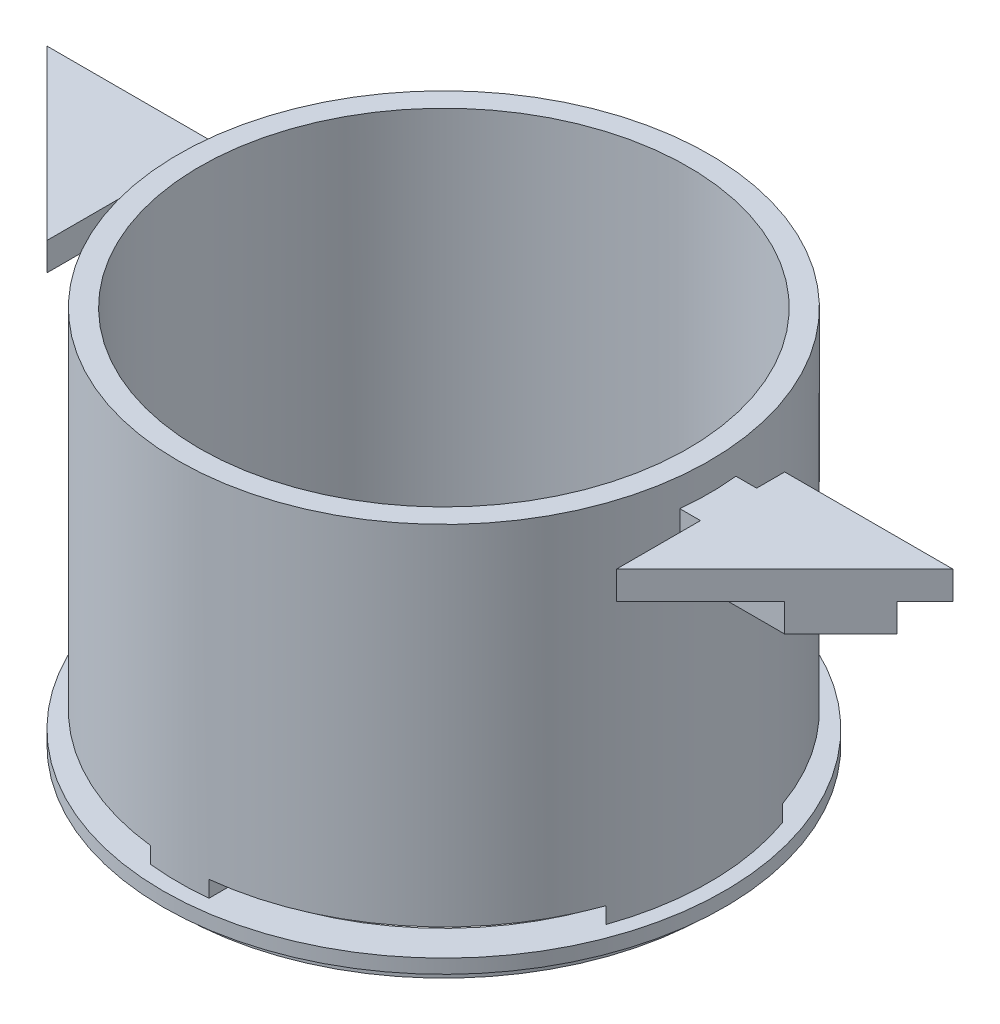
from build123d import *

# Parameters (mm, degrees)
SKETCH1_R               = 60.071
BOSS_EXTRUDE1_DEPTH     = 88.9
SKETCH2_R               = 55.245
CUT_EXTRUDE1_DEPTH      = 123.964466745
CUT_EXTRUDE4_DEPTH      = 123.964466745
CUT_EXTRUDE4_DEPTH_BACK = 123.964466745
SKETCH6_W               = 50.038
SKETCH6_H               = 3.683
BOSS_EXTRUDE7_START     = 3.175
SKETCH10_R              = 63.5
SKETCH10_R_2            = 60.071
BOSS_EXTRUDE7_DEPTH     = 3.175
BOSS_EXTRUDE6_START     = 12.7
BOSS_EXTRUDE6_DEPTH     = 12.7
BOSS_EXTRUDE8_DEPTH     = 6.35


with BuildPart() as part:
    # Sketch1 → Boss-Extrude1 (new body)
    with BuildSketch(Plane(origin=(0, 0, 0), x_dir=(1, 0, 0), z_dir=(0, 1, 0))):
        Circle(SKETCH1_R)
    extrude(amount=BOSS_EXTRUDE1_DEPTH)

    # Sketch2 → Cut-Extrude1 (cut, through all)
    with BuildSketch(Plane(origin=(0, 88.9, 0), x_dir=(1, 0, 0), z_dir=(0, 1, 0))):
        Circle(SKETCH2_R)
    extrude(amount=-CUT_EXTRUDE1_DEPTH, mode=Mode.SUBTRACT)

    # Sketch6 → Cut-Extrude4 (cut, two sides: drawn at the far end of the back side and taken through both)
    with BuildSketch(Plane.XY.offset(-CUT_EXTRUDE4_DEPTH_BACK)):
        with Locations((-31.623, 8.1915)):
            Rectangle(SKETCH6_W, SKETCH6_H)
        with Locations((31.623, 8.1915)):
            Rectangle(SKETCH6_W, SKETCH6_H)
    extrude(amount=CUT_EXTRUDE4_DEPTH + CUT_EXTRUDE4_DEPTH_BACK, mode=Mode.SUBTRACT)

    # Sketch10 → Boss-Extrude7 (add)
    with BuildSketch(Plane(origin=(0, 0, 0), x_dir=(1, 0, 0), z_dir=(0, 1, 0)).offset(BOSS_EXTRUDE7_START)):
        Circle(SKETCH10_R)
        Circle(SKETCH10_R_2, mode=Mode.SUBTRACT)
    extrude(amount=BOSS_EXTRUDE7_DEPTH)

    # Sketch9 → Boss-Extrude6 (add)
    with BuildSketch(Plane(origin=(0, 69.85, 0), x_dir=(1, 0, 0), z_dir=(0, 1, 0)).offset(BOSS_EXTRUDE6_START)):
        with BuildLine():
            Line((-83.4525636, -6.35), (-54.878844057, -6.35))
            ThreePointArc((-54.878844057, -6.35), (-55.245, 0), (-54.878844057, 6.35))
            Line((-54.878844057, 6.35), (-96.1525636, 6.35))
            Line((-96.1525636, 6.35), (-83.4525636, -6.35))
        make_face()
    boss_extrude6 = extrude(amount=-BOSS_EXTRUDE6_DEPTH)

    # Sketch11 → Boss-Extrude8 (add)
    with BuildSketch(Plane(origin=(0, 82.55, 0), x_dir=(1, 0, 0), z_dir=(0, 1, 0))):
        Polygon((-64.4025636, -25.4), (-64.4025636, 12.7), (-102.5025636, 12.7), align=None)
    boss_extrude8 = extrude(amount=-BOSS_EXTRUDE8_DEPTH)

    # Mirror1: Boss-Extrude6, Boss-Extrude8 across plane
    add(boss_extrude6.mirror(Plane(origin=(0, 0, 0), x_dir=(0, 0, 1), z_dir=(1, 0, 0))))
    add(boss_extrude8.mirror(Plane(origin=(0, 0, 0), x_dir=(0, 0, 1), z_dir=(1, 0, 0))))


solid = part.part
